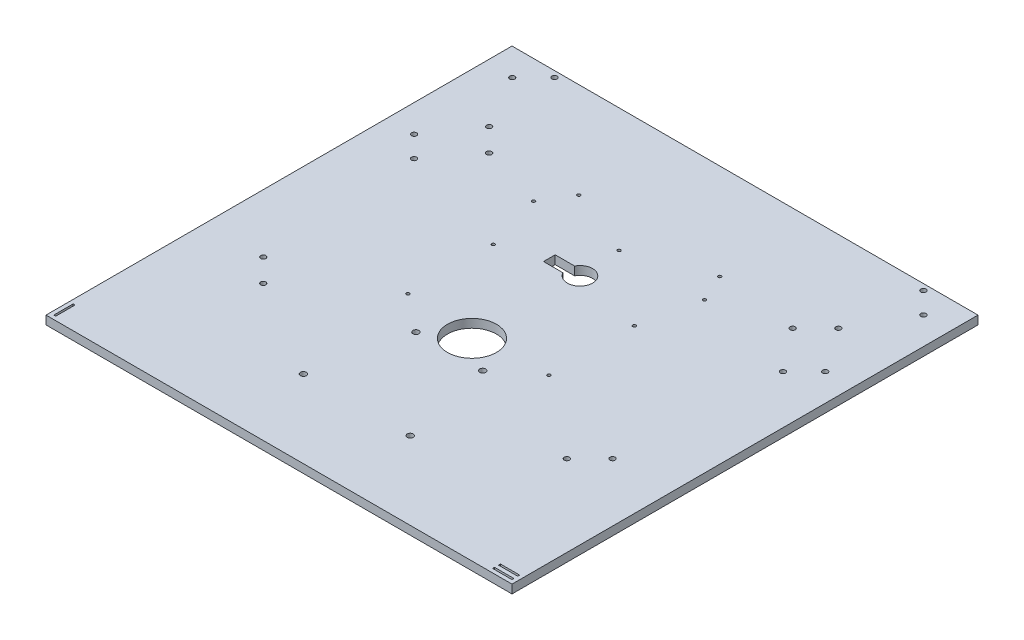
from build123d import *

# Parameters (mm, degrees)
SKETCH2_W            = 304.8
SKETCH2_H            = 304.8
BOSS_EXTRUDE1_DEPTH  = 5.588
SKETCH4_W            = 1.27
SKETCH4_H            = 12.7
SKETCH4_W_2          = 12.7
SKETCH4_H_2          = 1.27
CUT_EXTRUDE1_DEPTH   = 432.088512656
SKETCH5_W            = 228.854
SKETCH5_H            = 12.954
CUT_EXTRUDE2_DEPTH   = 0.254
SKETCH6_R            = 16.002
SKETCH6_R_2          = 1.7
SKETCH6_R_3          = 1.96
CUT_EXTRUDE3_DEPTH   = 432.088512656
CUT_EXTRUDE4_DEPTH   = 432.088512656
SKETCH8_R            = 1.016
CUT_EXTRUDE5_DEPTH   = 432.088512656
SKETCH9_R            = 1.016
CUT_EXTRUDE6_DEPTH   = 432.088512656
BOSS_EXTRUDE10_REACH = 433.089
SKETCH14_W           = 229.362
SKETCH14_H           = 13.498724556


with BuildPart() as part:
    # Sketch2 → Boss-Extrude1 (new body)
    with BuildSketch(Plane(origin=(0, 0, 0), x_dir=(1, 0, 0), z_dir=(0, 1, 0))):
        with Locations((152.4, 152.4)):
            Rectangle(SKETCH2_W, SKETCH2_H)
    extrude(amount=BOSS_EXTRUDE1_DEPTH)

    # Sketch4 → Cut-Extrude1 (cut, through all)
    with BuildSketch(Plane(origin=(0, 5.588, 0), x_dir=(1, 0, 0), z_dir=(0, 1, 0))):
        with Locations((3.175, 8.89)):
            Rectangle(SKETCH4_W, SKETCH4_H)
        with Locations((295.91, 3.175)):
            Rectangle(SKETCH4_W_2, SKETCH4_H_2)
        with Locations((295.91, 6.985)):
            Rectangle(SKETCH4_W_2, SKETCH4_H_2)
    extrude(amount=-CUT_EXTRUDE1_DEPTH, mode=Mode.SUBTRACT)

    # Sketch5 → Cut-Extrude2 (cut)
    with BuildSketch(Plane(origin=(0, 5.588, 0), x_dir=(1, 0, 0), z_dir=(0, 1, 0))):
        with Locations((148.97354, 274.58924)):
            Rectangle(SKETCH5_W, SKETCH5_H)
    extrude(amount=-CUT_EXTRUDE2_DEPTH, mode=Mode.SUBTRACT)

    # Sketch6 → Cut-Extrude3 (cut, through all)
    with BuildSketch(Plane(origin=(0, 5.588, 0), x_dir=(1, 0, 0), z_dir=(0, 1, 0))):
        with Locations((152.4799846, 126.1262654)):
            Circle(SKETCH6_R)
        with Locations((31.75, 300.832130008)):
            Circle(SKETCH6_R_2)
        with Locations((17.93875, 287.020880008)):
            Circle(SKETCH6_R_2)
        with Locations((273.05, 300.832130008)):
            Circle(SKETCH6_R_2)
        with Locations((286.86125, 287.020880008)):
            Circle(SKETCH6_R_2)
        with Locations((286.86125, 222.781740008)):
            Circle(SKETCH6_R_2)
        with Locations((273.05, 208.970490008)):
            Circle(SKETCH6_R_2)
        with Locations((31.75, 208.970490008)):
            Circle(SKETCH6_R_2)
        with Locations((17.93875, 222.781740008)):
            Circle(SKETCH6_R_2)
        with Locations((38.1787654, 103.9330154)):
            Circle(SKETCH6_R_2)
        with Locations((53.1330154, 88.9787654)):
            Circle(SKETCH6_R_2)
        with Locations((251.6669846, 88.9787654)):
            Circle(SKETCH6_R_2)
        with Locations((266.6212346, 103.9330154)):
            Circle(SKETCH6_R_2)
        with Locations((266.6212346, 251.6669846)):
            Circle(SKETCH6_R_2)
        with Locations((251.6669846, 236.7127346)):
            Circle(SKETCH6_R_2)
        with Locations((53.1330154, 236.7127346)):
            Circle(SKETCH6_R_2)
        with Locations((38.1787654, 251.6669846)):
            Circle(SKETCH6_R_2)
        with Locations((130.6518596, 111.328047494)):
            Circle(SKETCH6_R_3)
        with Locations((174.3081096, 111.328047494)):
            Circle(SKETCH6_R_3)
        with Locations((187.4049846, 50.821596477)):
            Circle(SKETCH6_R_3)
        with Locations((117.5549846, 50.821596477)):
            Circle(SKETCH6_R_3)
    extrude(amount=-CUT_EXTRUDE3_DEPTH, mode=Mode.SUBTRACT)

    # Sketch7 → Cut-Extrude4 (cut, through all)
    with BuildSketch(Plane(origin=(0, 5.588, 0), x_dir=(1, 0, 0), z_dir=(0, 1, 0))):
        with BuildLine():
            Line((145.076822752, 200.66), (132.376822752, 200.66))
            Line((132.376822752, 200.66), (132.376822752, 193.04))
            Line((132.376822752, 193.04), (145.076822752, 193.04))
            ThreePointArc((145.076822752, 193.04), (160.655, 196.85), (145.076822752, 200.66))
        make_face()
    extrude(amount=-CUT_EXTRUDE4_DEPTH, mode=Mode.SUBTRACT)

    # Sketch8 → Cut-Extrude5 (cut, through all)
    with BuildSketch(Plane(origin=(0, 5.588, 0), x_dir=(1, 0, 0), z_dir=(0, 1, 0))):
        with Locations((206.6999846, 223.9950154)):
            Circle(SKETCH8_R)
        with Locations((150.8199846, 223.9950154)):
            Circle(SKETCH8_R)
        with Locations((94.9399846, 223.9950154)):
            Circle(SKETCH8_R)
    extrude(amount=-CUT_EXTRUDE5_DEPTH, mode=Mode.SUBTRACT)

    # Sketch9 → Cut-Extrude6 (cut, through all)
    with BuildSketch(Plane(origin=(0, 5.588, 0), x_dir=(1, 0, 0), z_dir=(0, 1, 0))):
        with Locations((106.3, 242.18)):
            Circle(SKETCH9_R)
        with Locations((106.3, 186.3)):
            Circle(SKETCH9_R)
        with Locations((106.3, 130.42)):
            Circle(SKETCH9_R)
        with Locations((198.5, 130.42)):
            Circle(SKETCH9_R)
        with Locations((198.5, 186.3)):
            Circle(SKETCH9_R)
        with Locations((198.5, 242.18)):
            Circle(SKETCH9_R)
    extrude(amount=-CUT_EXTRUDE6_DEPTH, mode=Mode.SUBTRACT)

    # Sketch14 → Boss-Extrude10 (add, up to next)
    with BuildSketch(Plane(origin=(0, 5.588, 0), x_dir=(1, 0, 0), z_dir=(0, 1, 0)), mode=Mode.PRIVATE) as boss_extrude10_sk1:
        with Locations((148.97354, 274.58924)):
            Rectangle(SKETCH14_W, SKETCH14_H)
    boss_extrude10_tool1 = extrude(boss_extrude10_sk1.sketch, amount=-BOSS_EXTRUDE10_REACH, mode=Mode.PRIVATE) - part.part
    add(boss_extrude10_tool1.solids().sort_by_distance((148.97354, 5.588, -274.58924))[0])


solid = part.part
